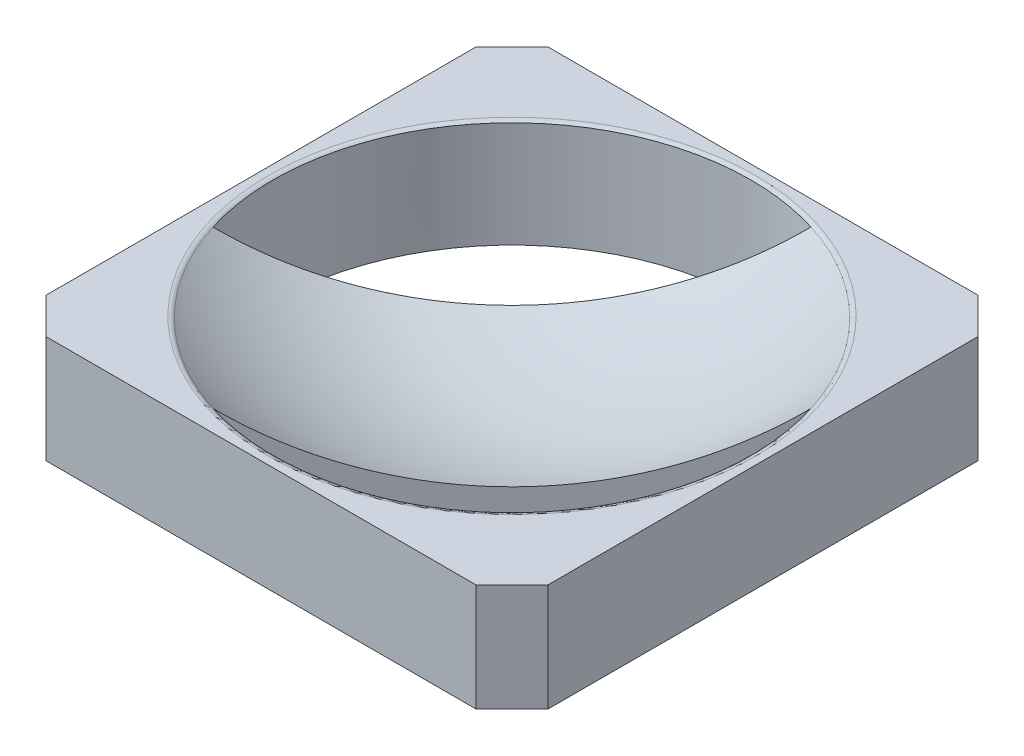
from build123d import *

# Parameters (mm, degrees)
SKETCH1_W           = 70
SKETCH1_H           = 70
BOSS_EXTRUDE1_DEPTH = 15
CHAMFER1_SIZE       = 5
FILLET1_R           = 1
CUT_EXTRUDE1_DEPTH  = 15


with BuildPart() as part:
    # Sketch1 → Boss-Extrude1 (new body)
    with BuildSketch(Plane(origin=(0, 0, 0), x_dir=(1, 0, 0), z_dir=(0, 1, 0))):
        with Locations((35, 35)):
            Rectangle(SKETCH1_W, SKETCH1_H)
    extrude(amount=BOSS_EXTRUDE1_DEPTH)

    # Sketch2 → Cut-Revolve3 (revolve, cut)
    with BuildSketch(Plane(origin=(0, 0, -35), x_dir=(-1, 0, 0), z_dir=(0, 0, -1))):
        with BuildLine():
            Line((-35, 109), (-35, 3))
            ThreePointArc((-35, 3), (18, 56), (-35, 109))
        make_face()
    revolve(axis=Axis((35, 0, -35), (0, 1, 0)), mode=Mode.SUBTRACT)

    # Chamfer1
    chamfer1_edges = [part.edges().sort_by_distance(p)[0] for p in [
        (0, 7.5, -70),
        (0, 7.5, 0),
        (70, 7.5, -70),
        (70, 7.5, 0),
    ]]
    chamfer(chamfer1_edges, length=CHAMFER1_SIZE)

    # Fillet1
    fillet1_edges = [part.edges().sort_by_distance(p)[0] for p in [
        (68.585711247, 15, -35),
    ]]
    fillet(fillet1_edges, radius=FILLET1_R)

    # Sketch3 → Cut-Extrude1 (cut)
    with BuildSketch(Plane(origin=(0, 15, 0), x_dir=(1, 0, 0), z_dir=(0, 1, 0))):
        with BuildLine():
            Line((66.810555525, 44.890245308), (25.109754692, 3.189444475))
            ThreePointArc((25.109754692, 3.189444475), (58.555555556, 11.444444444), (66.810555525, 44.890245308))
        make_face()
        with BuildLine():
            Line((44.890245308, 66.810555525), (3.189444475, 25.109754692))
            ThreePointArc((3.189444475, 25.109754692), (11.444444444, 58.555555556), (44.890245308, 66.810555525))
        make_face()
    extrude(amount=-CUT_EXTRUDE1_DEPTH, mode=Mode.SUBTRACT)


solid = part.part
